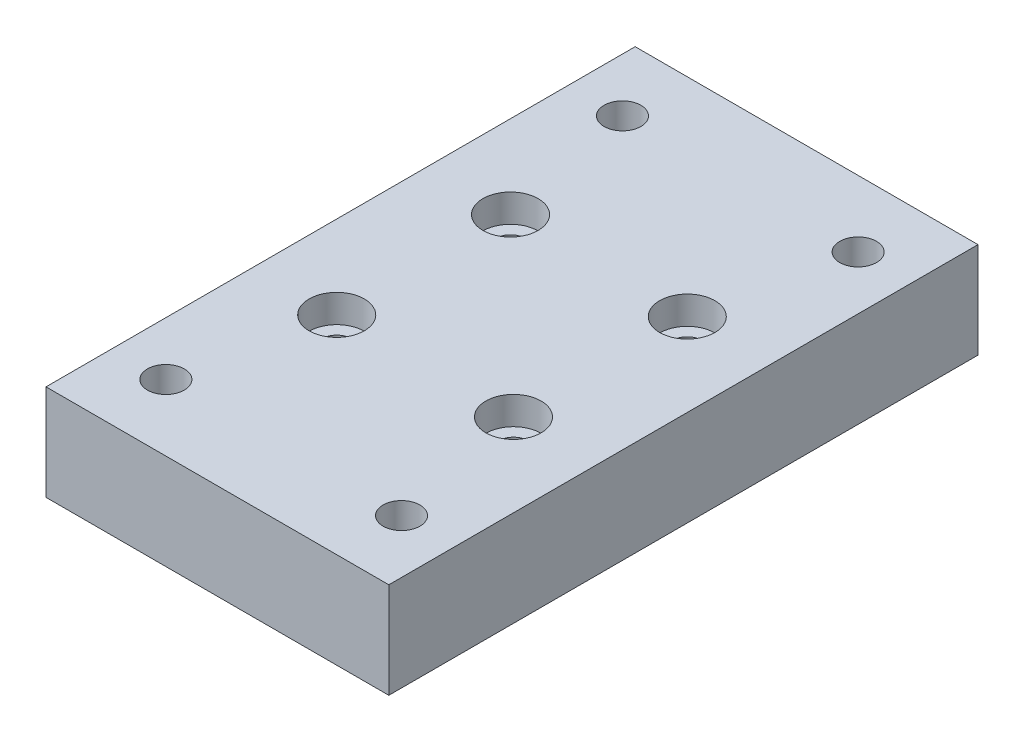
from build123d import *

# Parameters (mm, degrees)
SKETCH1_W                                       = 59.1185
SKETCH1_H                                       = 101.6
BOSS_EXTRUDE1_DEPTH                             = 16.51
CBORE_FOR_10_SOCKET_HEAD_CAP_SCREW1_D           = 5.1054
CBORE_FOR_10_SOCKET_HEAD_CAP_SCREW1_DEPTH       = 15.24
CBORE_FOR_10_SOCKET_HEAD_CAP_SCREW1_CBORE_D     = 9.525
CBORE_FOR_10_SOCKET_HEAD_CAP_SCREW1_CBORE_DEPTH = 4.826
F_1_4_0_25_DIAMETER_HOLE1_D                     = 6.35


with BuildPart() as part:
    # Sketch1 → Boss-Extrude1 (new body)
    with BuildSketch(Plane(origin=(0, 0, 0), x_dir=(1, 0, 0), z_dir=(0, 1, 0))):
        Rectangle(SKETCH1_W, SKETCH1_H)
    extrude(amount=BOSS_EXTRUDE1_DEPTH)

    # CBORE for #10 Socket Head Cap Screw1
    with Locations(Plane(origin=(-145.675301395, 16.51, 0), x_dir=(0, 0, 1), z_dir=(0, 1, 0))):
        with Locations((-14.986, 130.435301395), (14.986, 130.435301395), (14.986, 160.915301395), (-14.986, 160.915301395)):
            CounterBoreHole(CBORE_FOR_10_SOCKET_HEAD_CAP_SCREW1_D / 2, CBORE_FOR_10_SOCKET_HEAD_CAP_SCREW1_CBORE_D / 2, CBORE_FOR_10_SOCKET_HEAD_CAP_SCREW1_CBORE_DEPTH, depth=CBORE_FOR_10_SOCKET_HEAD_CAP_SCREW1_DEPTH)

    # 1/4 (0.25) Diameter Hole1 (through all)
    with Locations(Plane(origin=(0, 16.51, 0), x_dir=(1, 0, 0), z_dir=(0, 1, 0))):
        with Locations((20.32, -39.37), (-20.32, -39.37), (-20.32, 39.37), (20.32, 39.37)):
            Hole(F_1_4_0_25_DIAMETER_HOLE1_D / 2)


solid = part.part
